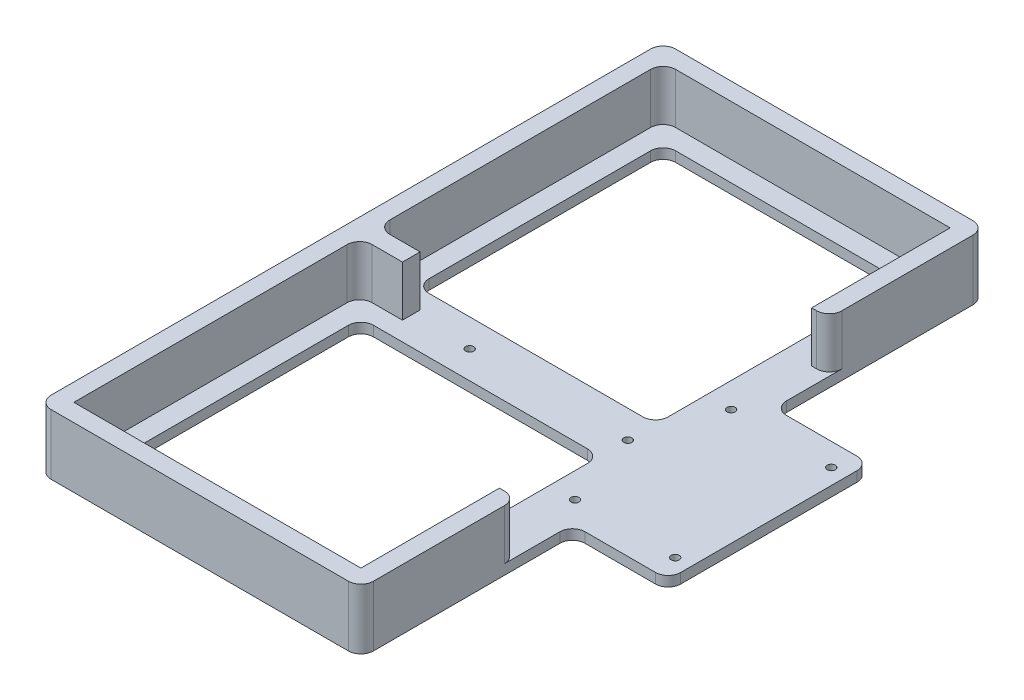
from build123d import *

# Parameters (mm, degrees)
SKETCH1_R           = 1.6
BOSS_EXTRUDE1_DEPTH = 2
BOSS_EXTRUDE2_DEPTH = 20
FILLET1_R           = 5


with BuildPart() as part:
    # Sketch1 → Boss-Extrude1 (new, symmetric)
    with BuildSketch(Plane(origin=(0, 0, 0), x_dir=(1, 0, 0), z_dir=(0, 1, 0))):
        Polygon((18, 40), (56, 40), (56, -40), (18, -40), (18, -124), (-110, -124), (-110, -22.904637916), (-110, 22.904637916), (-110, 124), (18, 124), align=None)
        Circle(SKETCH1_R, mode=Mode.SUBTRACT)
        with Locations((-62.8, 0)):
            Circle(SKETCH1_R, mode=Mode.SUBTRACT)
        with Locations((10, 31)):
            Circle(SKETCH1_R, mode=Mode.SUBTRACT)
        with Locations((49.8, 31)):
            Circle(SKETCH1_R, mode=Mode.SUBTRACT)
        with Locations((49.8, -31)):
            Circle(SKETCH1_R, mode=Mode.SUBTRACT)
        with Locations((10, -31)):
            Circle(SKETCH1_R, mode=Mode.SUBTRACT)
        Polygon((0, 11), (-95, 11), (-95, 109), (0, 109), (0, 40), align=None, mode=Mode.SUBTRACT)
        Polygon((0, -11), (0, -40), (0, -109), (-95, -109), (-95, -11), align=None, mode=Mode.SUBTRACT)
    extrude(amount=BOSS_EXTRUDE1_DEPTH, both=True)

    # Sketch2 → Boss-Extrude2 (add)
    with BuildSketch(Plane(origin=(0, 2, 0), x_dir=(1, 0, 0), z_dir=(0, 1, 0))):
        Polygon((18, 124), (-110, 124), (-110, -124), (18, -124), (18, -117), (18, -62), (11, -62), (11, -117), (-103, -117), (-103, -3.5), (-86, -3.5), (-86, 3.5), (-103, 3.5), (-103, 117), (11, 117), (11, 62), (18, 62), (18, 117), align=None)
    extrude(amount=BOSS_EXTRUDE2_DEPTH)

    # Fillet1
    fillet1_edges = [part.edges().sort_by_distance(p)[0] for p in [
        (56, 0, -40),
        (56, 0, 40),
        (18, 0, -40),
        (18, 0, 40),
        (18, 10, -124),
        (18, 10, 124),
        (-110, 10, -124),
        (0, 0, -109),
        (0, 0, -11),
        (-103, 12, -117),
        (-95, 0, -109),
        (-95, 0, -11),
        (0, 0, 109),
        (0, 0, 11),
        (-103, 12, -3.5),
        (-103, 12, 3.5),
        (-95, 0, 11),
        (-95, 0, 109),
        (-110, 10, 124),
        (18, 12, -62),
        (18, 12, 62),
    ]]
    fillet(fillet1_edges, radius=FILLET1_R)


solid = part.part
